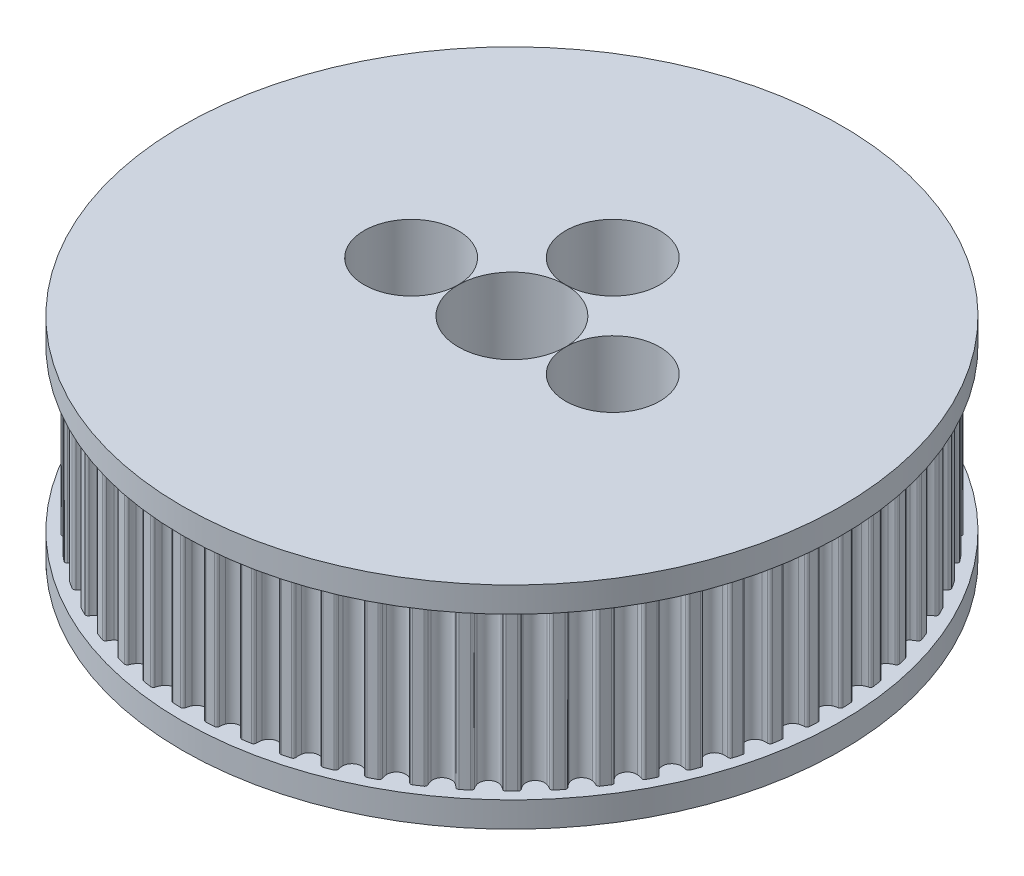
from build123d import *

# Parameters (mm, degrees)
GT2_SKETCH_R                                        = 18.844593171
GT2_SKETCH_R_2                                      = 3.175
PULLEY_BODY_DEPTH                                   = 9.5
TOOTH_EXTRUDE_DEPTH                                 = 29.292885741
TOOTH_PATTERN_COUNT                                 = 60
BOTTOM_START                                        = -1.5
GT2_SKETCH_4_R                                      = 19.474593171
GT2_SKETCH_4_R_2                                    = 3.175
BOTTOM_RETAINER_BOSS_EXTRUDE2_DEPTH                 = 1.5
TOP_START                                           = 9.5
GT2_SKETCH_5_R                                      = 19.474593171
GT2_SKETCH_5_R_2                                    = 3.175
TOP_RETAINER_BOSS_EXTRUDE3_DEPTH                    = 1.5
CBORE_FOR_2_BINDING_HEAD_MACHINE_SCREW1_D           = 2.2606
CBORE_FOR_2_BINDING_HEAD_MACHINE_SCREW1_CBORE_D     = 5.55752
CBORE_FOR_2_BINDING_HEAD_MACHINE_SCREW1_CBORE_DEPTH = 8


with BuildPart() as part:
    # GT2 Sketch → Pulley Body (new body)
    with BuildSketch(Plane(origin=(0, 0, 0), x_dir=(1, 0, 0), z_dir=(0, 1, 0))):
        Circle(GT2_SKETCH_R)
        Circle(GT2_SKETCH_R_2, mode=Mode.SUBTRACT)
    extrude(amount=PULLEY_BODY_DEPTH)

    # GT2 Sketch<3> → Tooth Extrude (cut, through all)
    with BuildSketch(Plane(origin=(0, 0, 0), x_dir=(1, 0, 0), z_dir=(0, 1, 0))):
        with BuildLine():
            ThreePointArc((0.59023039, 18.700906509), (0.642628143, 18.795132518), (0.744692585, 18.8298732))
            ThreePointArc((0.744692585, 18.8298732), (0, 18.844593171), (-0.744692585, 18.8298732))
            ThreePointArc((-0.744692585, 18.8298732), (-0.642628143, 18.795132518), (-0.59023039, 18.700906509))
            ThreePointArc((-0.59023039, 18.700906509), (-0.556292686, 18.547936262), (-0.498876404, 18.402145196))
            ThreePointArc((-0.498876404, 18.402145196), (0, 18.090347443), (0.498876404, 18.402145196))
            ThreePointArc((0.498876404, 18.402145196), (0.556292686, 18.547936262), (0.59023039, 18.700906509))
        make_face()
    tooth_extrude = extrude(amount=TOOTH_EXTRUDE_DEPTH, mode=Mode.SUBTRACT)

    # Tooth Pattern: Tooth Extrude ×60 about axis
    tooth_pattern_axis = Axis((0, -105.04218919, 0), (0, 1, 0))
    for i in range(1, TOOTH_PATTERN_COUNT):
        add(tooth_extrude.rotate(tooth_pattern_axis, i * 360 / TOOTH_PATTERN_COUNT), mode=Mode.SUBTRACT)

    # GT2 Sketch<4> → Bottom Retainer Boss-Extrude2 (add)
    with BuildSketch(Plane(origin=(0, 0, 0), x_dir=(1, 0, 0), z_dir=(0, 1, 0)).offset(BOTTOM_START)):
        Circle(GT2_SKETCH_4_R)
        Circle(GT2_SKETCH_4_R_2, mode=Mode.SUBTRACT)
    extrude(amount=BOTTOM_RETAINER_BOSS_EXTRUDE2_DEPTH)

    # GT2 Sketch<5> → Top Retainer Boss-Extrude3 (add)
    with BuildSketch(Plane(origin=(0, 0, 0), x_dir=(1, 0, 0), z_dir=(0, 1, 0)).offset(TOP_START)):
        Circle(GT2_SKETCH_5_R)
        Circle(GT2_SKETCH_5_R_2, mode=Mode.SUBTRACT)
    extrude(amount=TOP_RETAINER_BOSS_EXTRUDE3_DEPTH)

    # CBORE for #2 Binding Head Machine Screw1 (through all)
    with Locations(Plane(origin=(0, 11, 0), x_dir=(1, 0, 0), z_dir=(0, 1, 0))):
        with Locations((-5.9563, 0), (0, 5.9563), (5.9563, 0)):
            CounterBoreHole(CBORE_FOR_2_BINDING_HEAD_MACHINE_SCREW1_D / 2, CBORE_FOR_2_BINDING_HEAD_MACHINE_SCREW1_CBORE_D / 2, CBORE_FOR_2_BINDING_HEAD_MACHINE_SCREW1_CBORE_DEPTH)


solid = part.part
